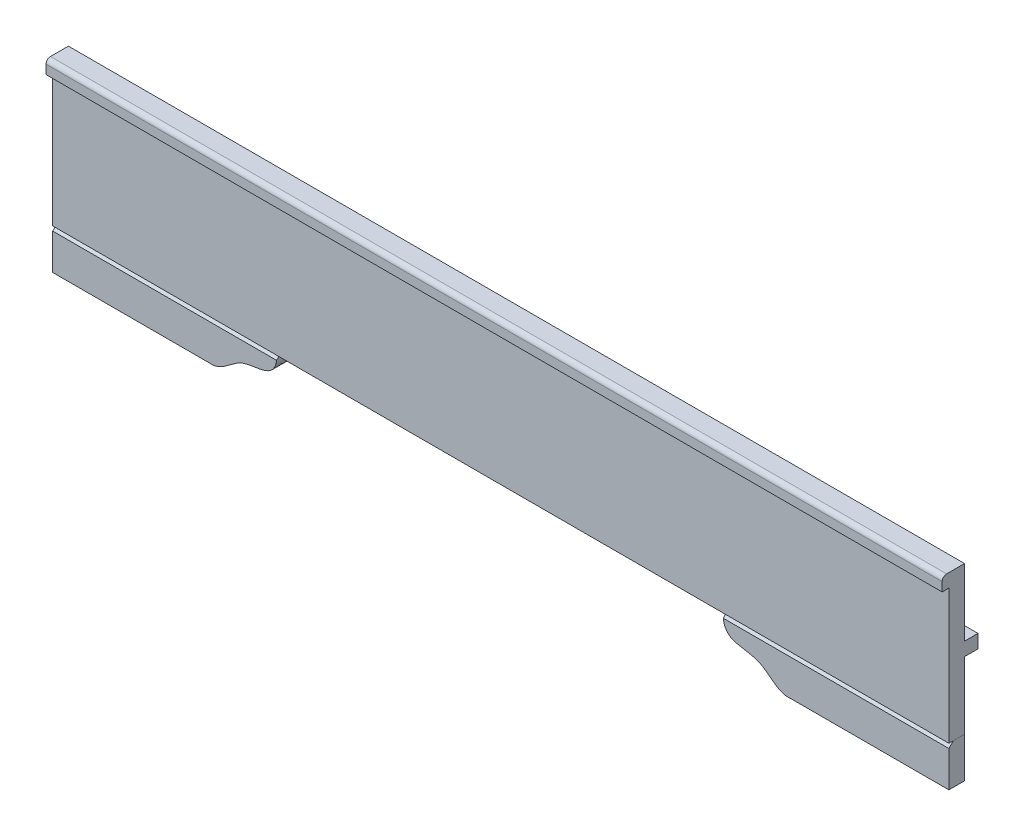
from build123d import *

# Parameters (mm, degrees)
SKETCH1_W             = 2000
SKETCH1_H             = 30
BOSS_EXTRUDE1_DEPTH   = 50
SKETCH2_W             = 2000
SKETCH2_H             = 300
BOSS_EXTRUDE2_DEPTH   = 35
FILLET1_R             = 10
BOSS_EXTRUDE3_DEPTH   = 35
BOSS_EXTRUDE3_2_DEPTH = 35
CHAMFER1_SIZE         = 10
CHAMFER2_SIZE         = 10
SKETCH6_W             = 2000
SKETCH6_H             = 30
BOSS_EXTRUDE4_DEPTH   = 30


with BuildPart() as part:
    # Sketch1 → Boss-Extrude1 (new body)
    with BuildSketch(Plane.XY):
        with Locations((-1000, -15)):
            Rectangle(SKETCH1_W, SKETCH1_H)
    extrude(amount=BOSS_EXTRUDE1_DEPTH)

    # Sketch2 → Boss-Extrude2 (add)
    with BuildSketch(Plane(origin=(0, 0, 0), x_dir=(-1, 0, 0), z_dir=(0, 0, -1))):
        with Locations((1000, -180)):
            Rectangle(SKETCH2_W, SKETCH2_H)
    extrude(amount=-BOSS_EXTRUDE2_DEPTH)

    # Fillet1
    fillet1_edges = [part.edges().sort_by_distance(p)[0] for p in [
        (-1000, 0, 50),
    ]]
    fillet(fillet1_edges, radius=FILLET1_R)

    # Sketch6 → Boss-Extrude4 (add)
    with BuildSketch(Plane(origin=(0, 0, 0), x_dir=(-1, 0, 0), z_dir=(0, 0, -1))):
        with Locations((1000, -165)):
            Rectangle(SKETCH6_W, SKETCH6_H)
    extrude(amount=BOSS_EXTRUDE4_DEPTH)


with BuildPart() as body_2:
    # Sketch3 → Boss-Extrude3 (new body)
    with BuildSketch(Plane.XY.offset(35)):
        with BuildLine():
            Line((-503.966493072, -330), (0, -330))
            Line((0, -330), (0, -420))
            Line((0, -420), (-353.966493072, -420))
            add(Edge.make_bspline(
                [(-503.966493072, -330), (-504.414495216, -385.6301706), (-422.344298333, -358.815027436), (-381.657255227, -423.699197751), (-353.966493072, -420)],
                knots=[0, 0, 0, 0, 0.572853035, 1, 1, 1, 1], degree=3))
        make_face()
    extrude(amount=-BOSS_EXTRUDE3_DEPTH)

    # Chamfer2
    chamfer2_edges = [body_2.edges().sort_by_distance(p)[0] for p in [
        (-251.983246536, -330, 35),
    ]]
    chamfer(chamfer2_edges, length=CHAMFER2_SIZE)


with BuildPart() as body_3:
    # Sketch3 → Boss-Extrude3 2 (new body)
    with BuildSketch(Plane.XY.offset(35)):
        with BuildLine():
            Line((-2000, -330), (-1500, -330))
            add(Edge.make_bspline(
                [(-1500, -330), (-1499.61965149, -385.542451224), (-1581.342955777, -359.113372387), (-1622.524460383, -423.231832414), (-1650, -420)],
                knots=[0, 0, 0, 0, 0.573311955, 1, 1, 1, 1], degree=3))
            Line((-1650, -420), (-2000, -420))
            Line((-2000, -420), (-2000, -330))
        make_face()
    extrude(amount=-BOSS_EXTRUDE3_2_DEPTH)

    # Chamfer1
    chamfer1_edges = [body_3.edges().sort_by_distance(p)[0] for p in [
        (-1750, -330, 35),
    ]]
    chamfer(chamfer1_edges, length=CHAMFER1_SIZE)


solid = Compound([part.part, body_2.part, body_3.part])
